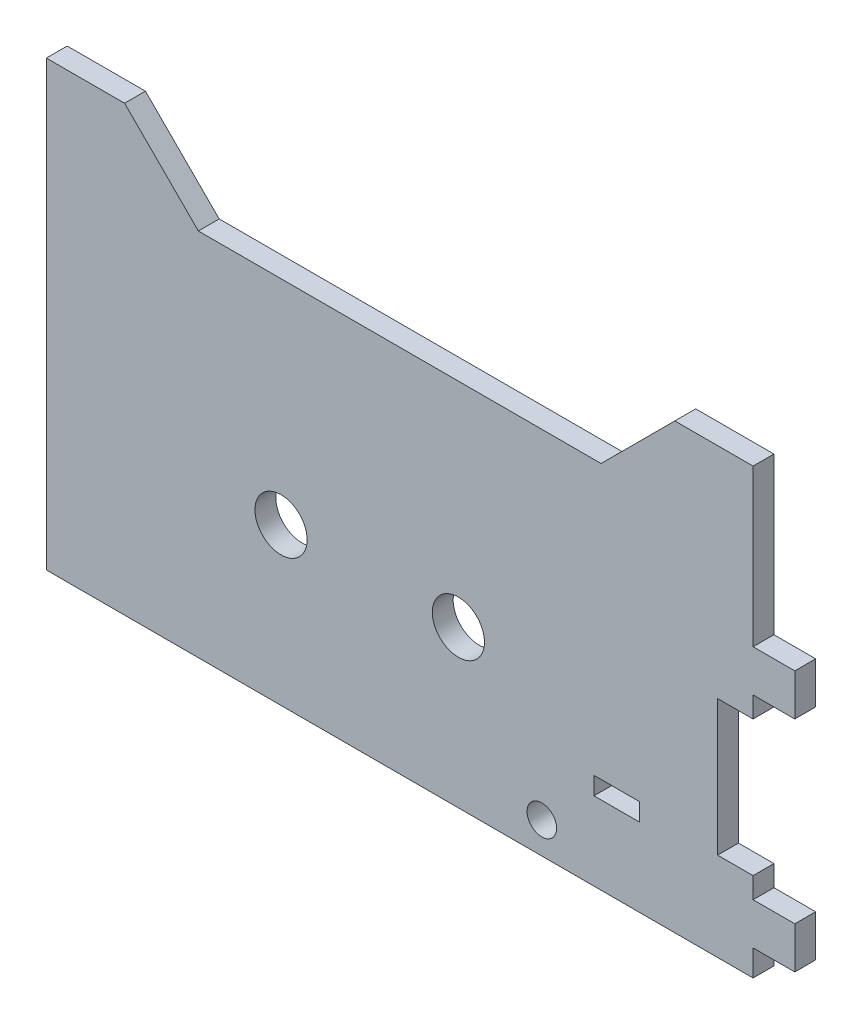
from build123d import *

# Parameters (mm, degrees)
SKETCH1_R           = 5
SKETCH1_R_2         = 2.83
SKETCH1_W           = 8.7
SKETCH1_H           = 3.4
BOSS_EXTRUDE1_DEPTH = 4
BOSS_EXTRUDE2_DEPTH = 4


with BuildPart() as part:
    # Sketch1 → Boss-Extrude1 (new body)
    with BuildSketch(Plane.XY):
        Polygon((49, 30), (56.5, 30), (56.5, 25), (64.5, 25), (64.5, 17), (56.5, 17), (56.5, 13), (49.7, 13), (49.7, -13), (56.5, -13), (56.5, -17), (64.5, -17), (64.5, -25), (56.5, -25), (56.5, -30), (49, -30), (-79, -30), (-79, 30), align=None)
        Circle(SKETCH1_R, mode=Mode.SUBTRACT)
        with Locations((-34, 0)):
            Circle(SKETCH1_R, mode=Mode.SUBTRACT)
        with Locations((16, -24)):
            Circle(SKETCH1_R_2, mode=Mode.SUBTRACT)
        with Locations((30.35, -13.3)):
            Rectangle(SKETCH1_W, SKETCH1_H, mode=Mode.SUBTRACT)
    extrude(amount=BOSS_EXTRUDE1_DEPTH)

    # Sketch2 → Boss-Extrude2 (add)
    with BuildSketch(Plane.XY):
        Polygon((-79, 30), (56.5, 30), (56.5, 55), (41.5, 55), (27.357864376, 40.857864376), (-49.857864376, 40.857864376), (-64, 55), (-79, 55), align=None)
    extrude(amount=BOSS_EXTRUDE2_DEPTH)


solid = part.part
